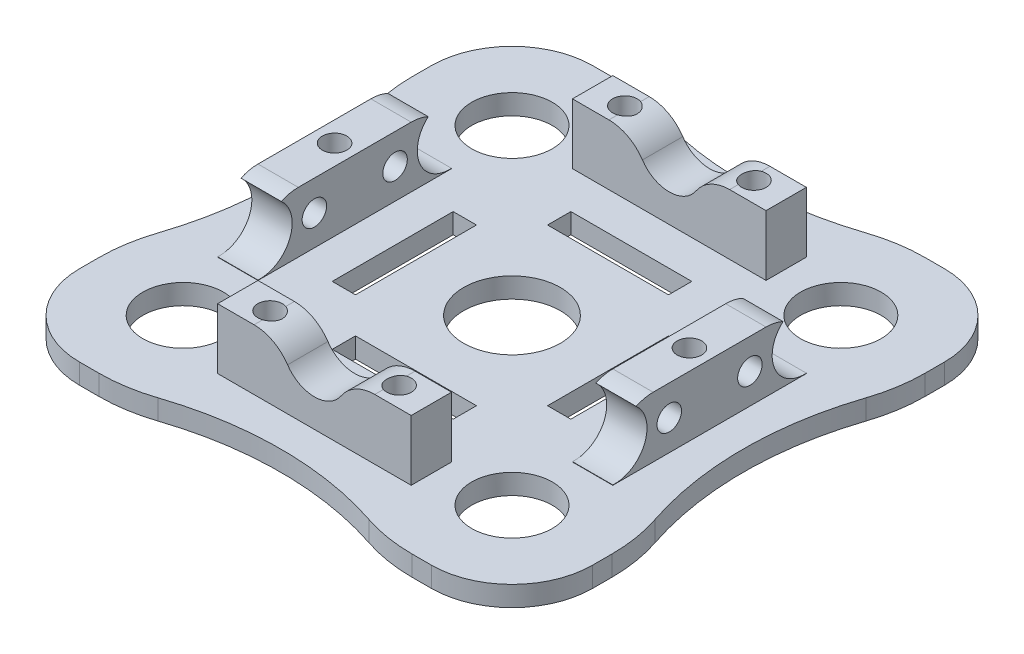
from build123d import *

# Parameters (mm, degrees)
EXTRUDE_1_DEPTH          = 2.5
FILLET_1_R               = 10
FILLET_2_R               = 10
FILLET_3_R               = 10
FILLET_4_R               = 10
SKETCH_2_R               = 5
SKETCH_2_R_2             = 1.52
SKETCH_2_W               = 15
SKETCH_2_H               = 2.887641603
CUT_EXTRUDE_1_DEPTH      = 49
FILLET_5_R               = 20
FILLET_6_R               = 20
PATTERN_CIRCULAR_2_COUNT = 4
SKETCH_3_R               = 6
CUT_EXTRUDE_2_DEPTH      = 49
FILLET_7_R               = 20
FILLET_8_R               = 20
FILLET_9_R               = 20
FILLET_10_R              = 20
FILLET_11_R              = 20
FILLET_12_R              = 20
SKETCH_6_W               = 24
SKETCH_6_H               = 5
SKETCH_6_W_2             = 5
SKETCH_6_H_2             = 24
EXTRUDE_2_DEPTH          = 7.5
SKETCH_7_R               = 1.52
CUT_EXTRUDE_4_DEPTH      = 16
SKETCH_8_R               = 4
CUT_EXTRUDE_5_DEPTH      = 57
FILLET_13_R              = 5
FILLET_14_R              = 5
FILLET_15_R              = 5
FILLET_16_R              = 5
FILLET_17_R              = 5
FILLET_18_R              = 5
FILLET_19_R              = 5
FILLET_20_R              = 5
SKETCH_9_R               = 4.001458819
CUT_EXTRUDE_6_DEPTH      = 57
SKETCH_10_R              = 1.52
CUT_EXTRUDE_7_DEPTH      = 57


with BuildPart() as part:
    # 草图1 → 凸台-拉伸1 (new body)
    with BuildSketch(Plane(origin=(0, 0, 0), x_dir=(1, 0, 0), z_dir=(0, 1, 0))):
        with BuildLine():
            Line((31.819805153, -31.819805153), (15.840551385, -31.819805153))
            ThreePointArc((15.840551385, -31.819805153), (0, -28.683478044), (-15.840551385, -31.819805153))
            Line((-15.840551385, -31.819805153), (-31.819805153, -31.819805153))
            Line((-31.819805153, -31.819805153), (-31.819805153, -15.840551385))
            ThreePointArc((-31.819805153, -15.840551385), (-28.683478044, 0), (-31.819805153, 15.840551385))
            Line((-31.819805153, 15.840551385), (-31.819805153, 31.819805153))
            Line((-31.819805153, 31.819805153), (-15.840551385, 31.819805153))
            ThreePointArc((-15.840551385, 31.819805153), (0, 28.683478044), (15.840551385, 31.819805153))
            Line((15.840551385, 31.819805153), (31.819805153, 31.819805153))
            Line((31.819805153, 31.819805153), (31.819805153, 15.840551385))
            ThreePointArc((31.819805153, 15.840551385), (28.683478044, 0), (31.819805153, -15.840551385))
            Line((31.819805153, -15.840551385), (31.819805153, -31.819805153))
        make_face()
    extrude(amount=EXTRUDE_1_DEPTH)

    # 圆角1
    fillet_1_edges = [part.edges().sort_by_distance(p)[0] for p in [
        (31.819805153, 1.25, 31.819805153),
    ]]
    fillet(fillet_1_edges, radius=FILLET_1_R)

    # 圆角2
    fillet_2_edges = [part.edges().sort_by_distance(p)[0] for p in [
        (31.819805153, 1.25, -31.819805153),
    ]]
    fillet(fillet_2_edges, radius=FILLET_2_R)

    # 圆角3
    fillet_3_edges = [part.edges().sort_by_distance(p)[0] for p in [
        (-31.819805153, 1.25, -31.819805153),
    ]]
    fillet(fillet_3_edges, radius=FILLET_3_R)

    # 圆角4
    fillet_4_edges = [part.edges().sort_by_distance(p)[0] for p in [
        (-31.819805153, 1.25, 31.819805153),
    ]]
    fillet(fillet_4_edges, radius=FILLET_4_R)

    # 草图2 → 切除-拉伸1 (cut)
    with BuildSketch(Plane(origin=(0, 2.5, 0), x_dir=(1, 0, 0), z_dir=(0, 1, 0))):
        with Locations(Location((-20.387793681, 20.387793681, 0), (0, 0, 270))):
            Circle(SKETCH_2_R)
        with Locations((-46.88466688, 53.955734692)):
            Circle(SKETCH_2_R_2)
        with Locations((-53.955734692, 46.88466688)):
            Circle(SKETCH_2_R_2)
        with Locations((0, 13.350698667)):
            Rectangle(SKETCH_2_W, SKETCH_2_H)
    cut_extrude_1 = extrude(amount=-CUT_EXTRUDE_1_DEPTH, mode=Mode.SUBTRACT)

    # 圆角5
    fillet_5_edges = [part.edges().sort_by_distance(p)[0] for p in [
        (-15.840551385, 1.25, -31.819805153),
    ]]
    fillet(fillet_5_edges, radius=FILLET_5_R)

    # 圆角6
    fillet_6_edges = [part.edges().sort_by_distance(p)[0] for p in [
        (-31.819805153, 1.25, -15.840551385),
    ]]
    fillet(fillet_6_edges, radius=FILLET_6_R)

    # 阵列(圆周)2: 切除-拉伸1 ×4 about axis
    pattern_circular_2_axis = Axis((0, 0, 0), (0, 1, 0))
    for i in range(1, PATTERN_CIRCULAR_2_COUNT):
        add(cut_extrude_1.rotate(pattern_circular_2_axis, i * 360 / PATTERN_CIRCULAR_2_COUNT), mode=Mode.SUBTRACT)

    # 草图3 → 切除-拉伸2 (cut)
    with BuildSketch(Plane(origin=(0, 2.5, 0), x_dir=(1, 0, 0), z_dir=(0, 1, 0))):
        with Locations(Location((0, 0, 0), (0, 0, 270))):
            Circle(SKETCH_3_R)
    extrude(amount=-CUT_EXTRUDE_2_DEPTH, mode=Mode.SUBTRACT)

    # 圆角7
    fillet_7_edges = [part.edges().sort_by_distance(p)[0] for p in [
        (31.819805153, 1.25, 15.840551385),
    ]]
    fillet(fillet_7_edges, radius=FILLET_7_R)

    # 圆角8
    fillet_8_edges = [part.edges().sort_by_distance(p)[0] for p in [
        (15.840551385, 1.25, 31.819805153),
    ]]
    fillet(fillet_8_edges, radius=FILLET_8_R)

    # 圆角9
    fillet_9_edges = [part.edges().sort_by_distance(p)[0] for p in [
        (-31.819805153, 1.25, 15.840551385),
    ]]
    fillet(fillet_9_edges, radius=FILLET_9_R)

    # 圆角10
    fillet_10_edges = [part.edges().sort_by_distance(p)[0] for p in [
        (-15.840551385, 1.25, 31.819805153),
    ]]
    fillet(fillet_10_edges, radius=FILLET_10_R)

    # 圆角11
    fillet_11_edges = [part.edges().sort_by_distance(p)[0] for p in [
        (15.840551385, 1.25, -31.819805153),
    ]]
    fillet(fillet_11_edges, radius=FILLET_11_R)

    # 圆角12
    fillet_12_edges = [part.edges().sort_by_distance(p)[0] for p in [
        (31.819805153, 1.25, -15.840551385),
    ]]
    fillet(fillet_12_edges, radius=FILLET_12_R)

    # 草图6 → 凸台-拉伸2 (add)
    with BuildSketch(Plane(origin=(0, 2.5, 0), x_dir=(1, 0, 0), z_dir=(0, 1, 0))):
        with Locations((0, 22)):
            Rectangle(SKETCH_6_W, SKETCH_6_H)
        with Locations((22, 0)):
            Rectangle(SKETCH_6_W_2, SKETCH_6_H_2)
        with Locations((0, -22)):
            Rectangle(SKETCH_6_W, SKETCH_6_H)
        with Locations((-22, 0)):
            Rectangle(SKETCH_6_W_2, SKETCH_6_H_2)
    extrude(amount=EXTRUDE_2_DEPTH)

    # 草图7 → 切除-拉伸4 (cut)
    with BuildSketch(Plane.XZ):
        with Locations(Location((-22, 0, 0), (0, 0, 270))):
            Circle(SKETCH_7_R)
        with Locations(Location((22, 0, 0), (0, 0, 270))):
            Circle(SKETCH_7_R)
        with Locations(Location((-8, 22, 0), (0, 0, 270))):
            Circle(SKETCH_7_R)
        with Locations(Location((8, 22, 0), (0, 0, 90))):
            Circle(SKETCH_7_R)
        with Locations(Location((-8, -22, 0), (0, 0, 270))):
            Circle(SKETCH_7_R)
        with Locations(Location((8, -22, 0), (0, 0, 270))):
            Circle(SKETCH_7_R)
    extrude(amount=-CUT_EXTRUDE_4_DEPTH, mode=Mode.SUBTRACT)

    # 草图8 → 切除-拉伸5 (cut)
    with BuildSketch(Plane(origin=(0, 0, -24.5), x_dir=(-1, 0, 0), z_dir=(0, 0, -1))):
        with Locations((0, 10)):
            Circle(SKETCH_8_R)
    extrude(amount=-CUT_EXTRUDE_5_DEPTH, mode=Mode.SUBTRACT)

    # 圆角13
    # the kernel refuses this fillet: 5 mm, written as the material it takes off along each edge
    with BuildSketch(Plane(origin=(-4, 10, 10.791713066), x_dir=(-1, 0, 0), z_dir=(0, 0, 1))) as fillet_13_piece_1:
        with BuildLine():
            CenterArc((3.483314774, 5), FILLET_13_R, 213.748988596, 56.251011404)
            ThreePointArc((-0.674082323, 2.222222222), (-0.172228409, 1.161104925), (0, 0))
            Line((0, 0), (3.483314774, 0))
        make_face()
    extrude(amount=22.416573868, mode=Mode.SUBTRACT)

    # 圆角14
    # the kernel refuses this fillet: 5 mm, written as the material it takes off along each edge
    with BuildSketch(Plane(origin=(4, 10, 33.208286934), x_dir=(1, 0, 0), z_dir=(0, 0, -1))) as fillet_14_piece_1:
        with BuildLine():
            CenterArc((3.483314774, 5), FILLET_14_R, 213.748988596, 56.251011404)
            ThreePointArc((-0.674082323, 2.222222222), (-0.172228409, 1.161104925), (0, 0))
            Line((0, 0), (3.483314774, 0))
        make_face()
    extrude(amount=22.416573868, mode=Mode.SUBTRACT)

    # 圆角15
    # the kernel refuses this fillet: 5 mm, written as the material it takes off along each edge
    with BuildSketch(Plane(origin=(-4, 10, -33.208286934), x_dir=(-1, 0, 0), z_dir=(0, 0, 1))) as fillet_15_piece_1:
        with BuildLine():
            CenterArc((3.483314774, 5), FILLET_15_R, 213.748988596, 56.251011404)
            ThreePointArc((-0.674082323, 2.222222222), (-0.172228409, 1.161104925), (0, 0))
            Line((0, 0), (3.483314774, 0))
        make_face()
    extrude(amount=22.416573868, mode=Mode.SUBTRACT)

    # 圆角16
    # the kernel refuses this fillet: 5 mm, written as the material it takes off along each edge
    with BuildSketch(Plane(origin=(4, 10, -10.791713066), x_dir=(1, 0, 0), z_dir=(0, 0, -1))) as fillet_16_piece_1:
        with BuildLine():
            CenterArc((3.483314774, 5), FILLET_16_R, 213.748988596, 56.251011404)
            ThreePointArc((-0.674082323, 2.222222222), (-0.172228409, 1.161104925), (0, 0))
            Line((0, 0), (3.483314774, 0))
        make_face()
    extrude(amount=22.416573868, mode=Mode.SUBTRACT)

    # 圆角17
    fillet_17_edges = [part.edges().sort_by_distance(p)[0] for p in [
        (-22, 10, -12),
    ]]
    fillet(fillet_17_edges, radius=FILLET_17_R)

    # 圆角18
    fillet_18_edges = [part.edges().sort_by_distance(p)[0] for p in [
        (-22, 10, 12),
    ]]
    fillet(fillet_18_edges, radius=FILLET_18_R)

    # 圆角19
    fillet_19_edges = [part.edges().sort_by_distance(p)[0] for p in [
        (22, 10, 12),
    ]]
    fillet(fillet_19_edges, radius=FILLET_19_R)

    # 圆角20
    fillet_20_edges = [part.edges().sort_by_distance(p)[0] for p in [
        (22, 10, -12),
    ]]
    fillet(fillet_20_edges, radius=FILLET_20_R)

    # 草图9 → 切除-拉伸6 (cut)
    with BuildSketch(Plane(origin=(24.5, 0, 0), x_dir=(0, 0, -1), z_dir=(1, 0, 0))):
        with Locations((11.758178517, 6.536143614)):
            Circle(SKETCH_9_R)
        with Locations((-11.758178517, 6.536143614)):
            Circle(SKETCH_9_R)
    extrude(amount=-CUT_EXTRUDE_6_DEPTH, mode=Mode.SUBTRACT)

    # 草图10 → 切除-拉伸7 (cut)
    with BuildSketch(Plane.ZY.offset(24.5)):
        with Locations((-5, 6.25)):
            Circle(SKETCH_10_R)
        with Locations((5, 6.25)):
            Circle(SKETCH_10_R)
    extrude(amount=-CUT_EXTRUDE_7_DEPTH, mode=Mode.SUBTRACT)


solid = part.part
